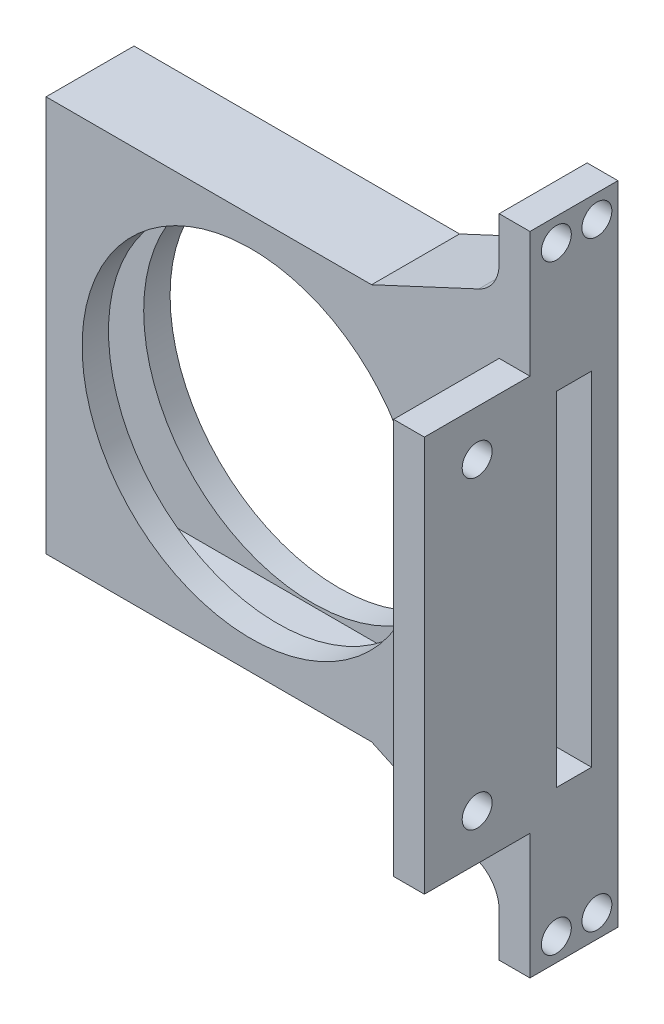
from build123d import *

# Parameters (mm, degrees)
SKETCH_1_W          = 55
SKETCH_1_H          = 45
EXTRUDE_1_DEPTH     = 3
SKETCH_2_W          = 3.5
SKETCH_2_H          = 45
EXTRUDE_2_DEPTH     = 12
SKETCH_3_R          = 1.7
CUT_EXTRUDE_1_DEPTH = 59.167860542
EXTRUDE_START       = -7
EXTRUDE_3_DEPTH     = 10
SKETCH_6_R          = 1.7
CUT_EXTRUDE_2_DEPTH = 66.018535195
SKETCH_7_R          = 19.2
CUT_EXTRUDE_3_DEPTH = 48.438485631
SKETCH_10_W         = 55
SKETCH_10_H         = 4
EXTRUDE_9_DEPTH     = 3


with BuildPart() as part:
    # 草图1 → 凸台-拉伸1 (new body)
    with BuildSketch(Plane.XY):
        Rectangle(SKETCH_1_W, SKETCH_1_H)
    extrude_1 = extrude(amount=EXTRUDE_1_DEPTH)

    # 草图2 → 凸台-拉伸2 (add)
    with BuildSketch(Plane.XY.offset(3)):
        with Locations((25.75, 0)):
            Rectangle(SKETCH_2_W, SKETCH_2_H)
    extrude(amount=EXTRUDE_2_DEPTH)

    # 草图3 → 切除-拉伸1 (cut, through all)
    with BuildSketch(Plane.ZY.offset(-24)):
        with Locations((9, -17.3)):
            Circle(SKETCH_3_R)
        with Locations((9, 17.3)):
            Circle(SKETCH_3_R)
    extrude(amount=-CUT_EXTRUDE_1_DEPTH, mode=Mode.SUBTRACT)

    # 草图5 → 凸台-拉伸3 (add)
    with BuildSketch(Plane.XY.offset(EXTRUDE_START)):
        with BuildLine():
            Line((27.5, -22.5), (9.5, -22.5))
            Line((9.5, -22.5), (21.689237996, -28.178880611))
            ThreePointArc((21.689237996, -28.178880611), (23.373199667, -29.654914404), (24, -31.804687417))
            Line((24, -31.804687417), (24, -36.744522299))
            Line((24, -36.744522299), (27.5, -36.744522299))
            Line((27.5, -36.744522299), (27.5, -22.5))
        make_face()
    extrude_3 = extrude(amount=EXTRUDE_3_DEPTH)

    # 草图6 → 切除-拉伸2 (cut, through all)
    with BuildSketch(Plane.ZY.offset(-24)):
        with Locations((0, -34.129434576)):
            Circle(SKETCH_6_R)
        with Locations((-4.607898424, -34.129434576)):
            Circle(SKETCH_6_R)
    cut_extrude_2 = extrude(amount=-CUT_EXTRUDE_2_DEPTH, mode=Mode.SUBTRACT)

    # 镜向3: 凸台-拉伸3, 切除-拉伸2 across plane
    add(extrude_3.mirror(Plane.ZX))
    add(cut_extrude_2.mirror(Plane.ZX), mode=Mode.SUBTRACT)

    # 草图7 → 切除-拉伸3 (cut, symmetric)
    with BuildSketch(Plane.XY.offset(3)):
        with Locations((-4.204977357, 0)):
            Circle(SKETCH_7_R)
    cut_extrude_3 = extrude(amount=CUT_EXTRUDE_3_DEPTH, both=True, mode=Mode.SUBTRACT)

    # 镜向6: 凸台-拉伸1, 切除-拉伸3 across plane
    add(extrude_1.mirror(Plane.XY.offset(-2)))
    add(cut_extrude_3.mirror(Plane.XY.offset(-2)), mode=Mode.SUBTRACT)

    # 草图10 → 凸台-拉伸9 (add)
    with BuildSketch(Plane(origin=(0, -22.5, 0), x_dir=(-1, 0, 0), z_dir=(0, -1, 0))):
        with Locations((0, 2)):
            Rectangle(SKETCH_10_W, SKETCH_10_H)
    extrude_9 = extrude(amount=-EXTRUDE_9_DEPTH)

    # 镜向7: 凸台-拉伸9 across plane
    add(extrude_9.mirror(Plane.ZX))


solid = part.part
